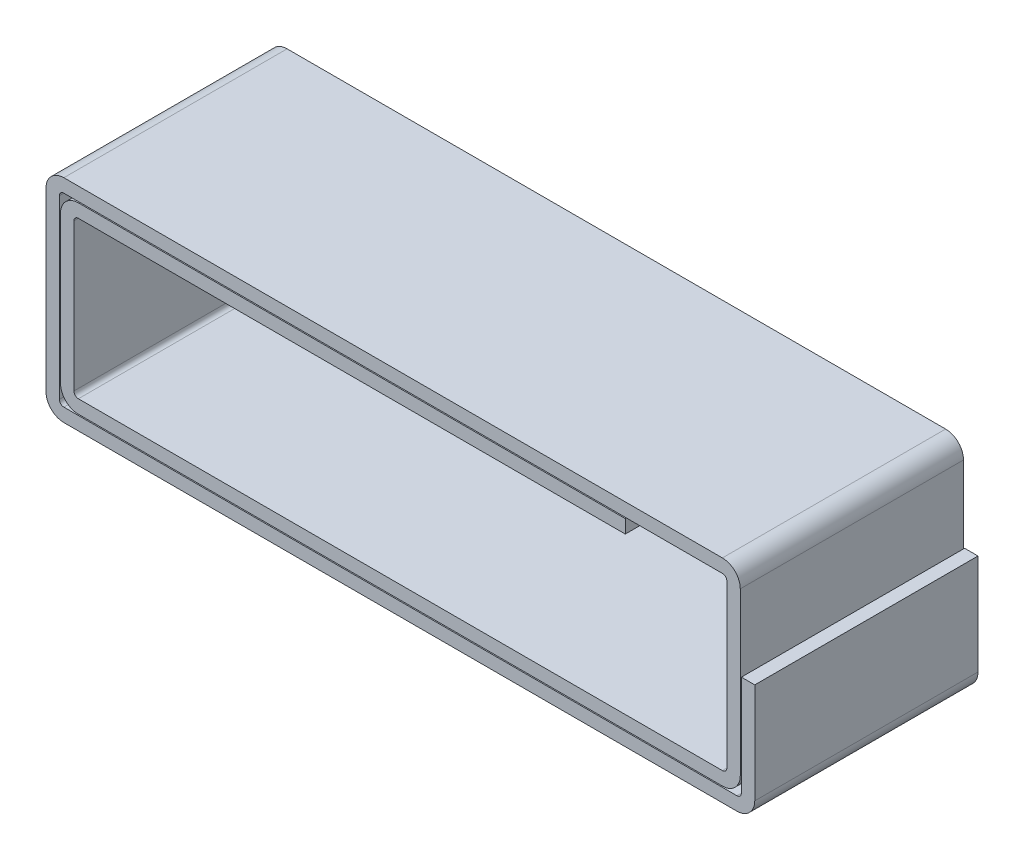
from build123d import *

# Parameters (mm, degrees)
BOSS_EXTRUDE2_DEPTH = 10


with BuildPart() as part:
    # Sketch1 → Boss-Extrude2 (new, symmetric)
    with BuildSketch(Plane.XY):
        with BuildLine():
            Line((-28.85, 15.8), (20.15, 15.8))
            Line((20.15, 15.8), (20.15, 14.6))
            Line((20.15, 14.6), (-28.85, 14.6))
            ThreePointArc((-28.85, 14.6), (-29.132842712, 14.482842712), (-29.25, 14.2))
            Line((-29.25, 14.2), (-29.25, 1))
            ThreePointArc((-29.25, 1), (-29.132842712, 0.717157288), (-28.85, 0.6))
            Line((-28.85, 0.6), (28.85, 0.6))
            ThreePointArc((28.85, 0.6), (29.132842712, 0.717157288), (29.25, 1))
            Line((29.25, 1), (29.25, 15.5))
            ThreePointArc((29.25, 15.5), (29.132842712, 15.782842712), (28.85, 15.9))
            Line((28.85, 15.9), (-30.15, 15.9))
            ThreePointArc((-30.15, 15.9), (-30.432842712, 15.782842712), (-30.55, 15.5))
            Line((-30.55, 15.5), (-30.55, -0.3))
            ThreePointArc((-30.55, -0.3), (-30.432842712, -0.582842712), (-30.15, -0.7))
            Line((-30.15, -0.7), (30.15, -0.7))
            ThreePointArc((30.15, -0.7), (30.432842712, -0.582842712), (30.55, -0.3))
            Line((30.55, -0.3), (30.55, 8.7))
            Line((30.55, 8.7), (31.75, 8.7))
            Line((31.75, 8.7), (31.75, -0.3))
            ThreePointArc((31.75, -0.3), (31.28137085, -1.43137085), (30.15, -1.9))
            Line((30.15, -1.9), (-30.15, -1.9))
            ThreePointArc((-30.15, -1.9), (-31.28137085, -1.43137085), (-31.75, -0.3))
            Line((-31.75, -0.3), (-31.75, 15.5))
            ThreePointArc((-31.75, 15.5), (-31.28137085, 16.63137085), (-30.15, 17.1))
            Line((-30.15, 17.1), (28.85, 17.1))
            ThreePointArc((28.85, 17.1), (29.98137085, 16.63137085), (30.45, 15.5))
            Line((30.45, 15.5), (30.45, 1))
            ThreePointArc((30.45, 1), (29.98137085, -0.13137085), (28.85, -0.6))
            Line((28.85, -0.6), (-28.85, -0.6))
            ThreePointArc((-28.85, -0.6), (-29.98137085, -0.13137085), (-30.45, 1))
            Line((-30.45, 1), (-30.45, 14.2))
            ThreePointArc((-30.45, 14.2), (-29.98137085, 15.33137085), (-28.85, 15.8))
        make_face()
    extrude(amount=BOSS_EXTRUDE2_DEPTH, both=True)


solid = part.part
